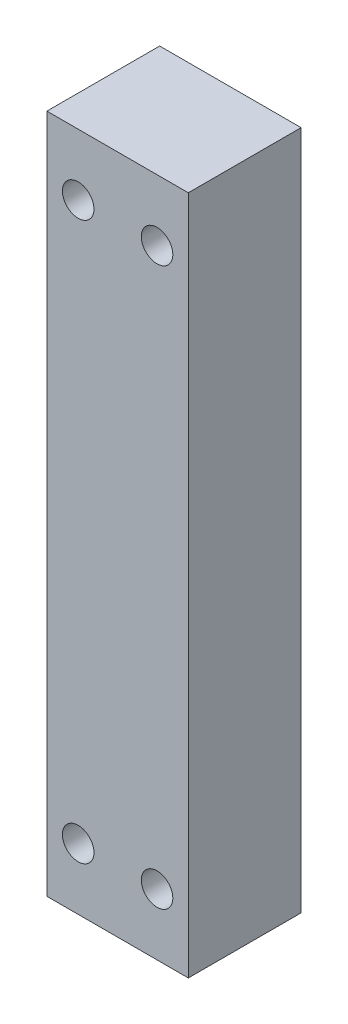
from build123d import *

# Parameters (mm, degrees)
ESBO_O1_W             = 26.9
ESBO_O1_H             = 129.35
FLANGE_BASE1_DEPTH    = 21.45
ESBO_O7_R             = 3
CORTE_EXTRUS_O1_DEPTH = 21.45


# Sheet-metal steps are written as plain solids
with BuildPart() as part:
    # Esboço1 → Flange-base1 (new body)
    with BuildSketch(Plane.XY):
        with Locations((16.336467182, -5.988425926)):
            Rectangle(ESBO_O1_W, ESBO_O1_H)
    extrude(amount=-FLANGE_BASE1_DEPTH)

    # Esboço7 → Corte-extrusão1 (cut)
    with BuildSketch(Plane(origin=(0, 0, -21.45), x_dir=(-1, 0, 0), z_dir=(0, 0, -1))):
        with Locations(Location((-23.836467182, 47.011574074, 0), (0, 0, 180))):
            Circle(ESBO_O7_R)
        with Locations(Location((-8.836467182, 47.011574074, 0), (0, 0, 180))):
            Circle(ESBO_O7_R)
        with Locations(Location((-23.836467182, -58.988425926, 0), (0, 0, 180))):
            Circle(ESBO_O7_R)
        with Locations(Location((-8.836467182, -58.988425926, 0), (0, 0, 180))):
            Circle(ESBO_O7_R)
    extrude(amount=-CORTE_EXTRUS_O1_DEPTH, mode=Mode.SUBTRACT)


solid = part.part
